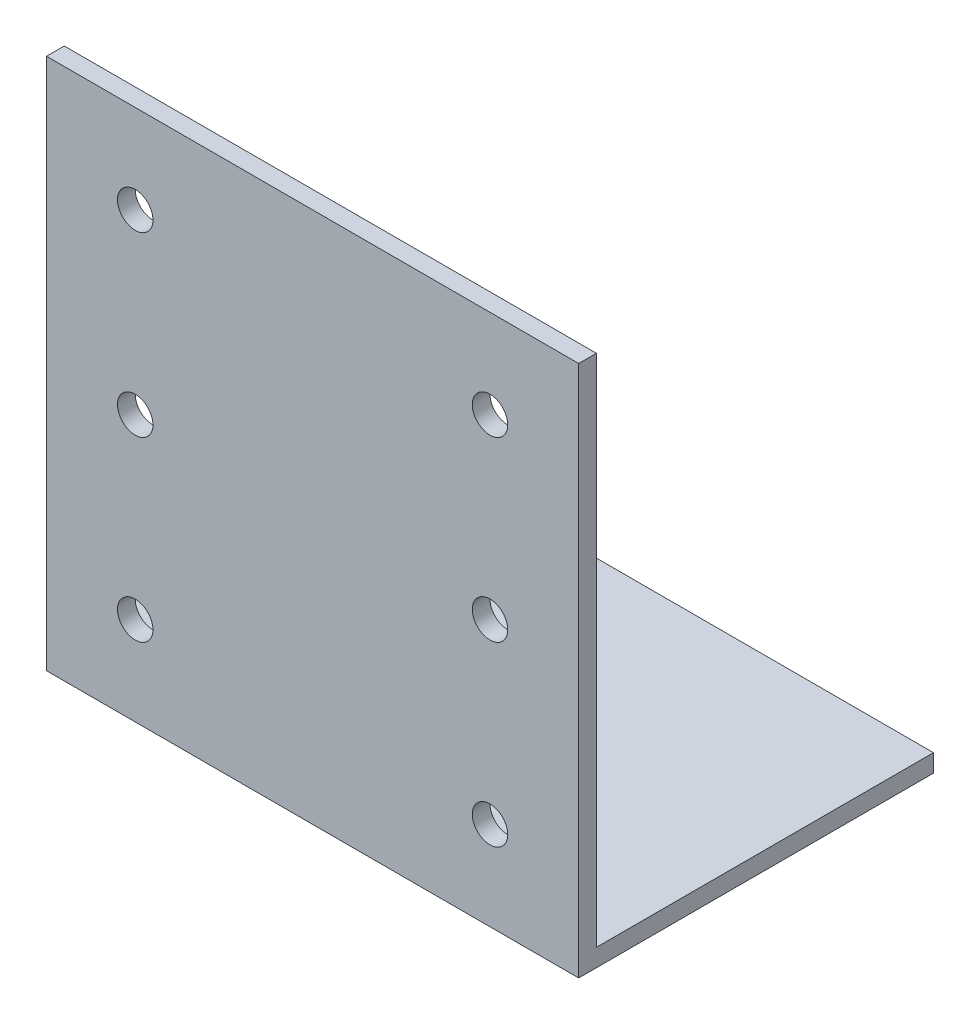
from build123d import *

# Parameters (mm, degrees)
EXTRUDE_1_DEPTH     = 60
SKETCH_2_R          = 2
CUT_EXTRUDE_1_DEPTH = 94.808315196


with BuildPart() as part:
    # Эскиз1 → Вытянуть-Тонкостенный1 (new body)
    with BuildSketch(Plane(origin=(0, 0, 0), x_dir=(0, 0, -1), z_dir=(1, 0, 0))):
        Polygon((40, 0), (0, 0), (0, 60), (2, 60), (2, 2), (40, 2), align=None)
    extrude(amount=EXTRUDE_1_DEPTH)

    # Эскиз2 → Вырез-Вытянуть1 (cut, through all)
    with BuildSketch(Plane.XY):
        with Locations((10, 50)):
            Circle(SKETCH_2_R)
        with Locations((50, 50)):
            Circle(SKETCH_2_R)
        with Locations((50, 30)):
            Circle(SKETCH_2_R)
        with Locations((50, 10)):
            Circle(SKETCH_2_R)
        with Locations((10, 30)):
            Circle(SKETCH_2_R)
        with Locations((10, 10)):
            Circle(SKETCH_2_R)
    extrude(amount=-CUT_EXTRUDE_1_DEPTH, mode=Mode.SUBTRACT)


solid = part.part
